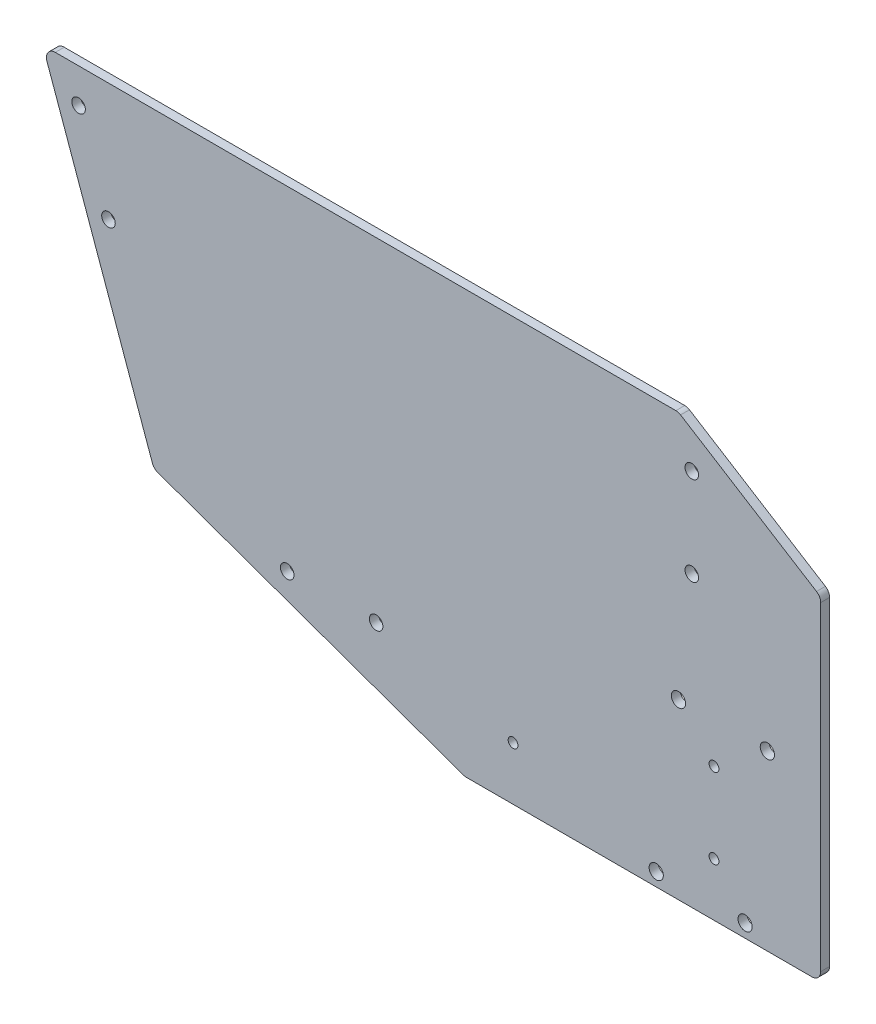
from build123d import *

# Parameters (mm, degrees)
SKETCH_1_R          = 1.6
SKETCH_1_R_2        = 1.525
EXTRUDE_1_DEPTH     = 2
SKETCH_4_R          = 1.1
CUT_EXTRUDE_2_DEPTH = 10
SKETCH_5_OUTSIDE_W  = 216.826
SKETCH_5_OUTSIDE_H  = 136.826
CUT_EXTRUDE_3_DEPTH = 10


with BuildPart() as part:
    # 草图1 → 凸台-拉伸1 (new body)
    with BuildSketch(Plane.XY):
        Polygon((0, 0), (0, 75), (-32, 95), (-175, 95), (-150, 25), (-80, 0), align=None)
        with Locations((-17, 3)):
            Circle(SKETCH_1_R, mode=Mode.SUBTRACT)
        with Locations((-37, 3)):
            Circle(SKETCH_1_R, mode=Mode.SUBTRACT)
        with Locations((-166.927926472, 87.264262869)):
            Circle(SKETCH_1_R_2, mode=Mode.SUBTRACT)
        with Locations((-160.201198532, 68.429424637)):
            Circle(SKETCH_1_R_2, mode=Mode.SUBTRACT)
        with Locations((-29, 85)):
            Circle(SKETCH_1_R_2, mode=Mode.SUBTRACT)
        with Locations((-29, 65)):
            Circle(SKETCH_1_R_2, mode=Mode.SUBTRACT)
        with Locations((-12, 39)):
            Circle(SKETCH_1_R, mode=Mode.SUBTRACT)
        with Locations((-32, 39)):
            Circle(SKETCH_1_R, mode=Mode.SUBTRACT)
        with Locations((-120, 20)):
            Circle(SKETCH_1_R_2, mode=Mode.SUBTRACT)
        with Locations((-100, 20)):
            Circle(SKETCH_1_R_2, mode=Mode.SUBTRACT)
    extrude(amount=EXTRUDE_1_DEPTH)

    # 草图4 → 切除-拉伸2 (cut)
    with BuildSketch(Plane(origin=(0, 0, 0), x_dir=(-1, 0, 0), z_dir=(0, 0, -1))):
        with Locations((24, 30)):
            Circle(SKETCH_4_R)
        with Locations((24, 12)):
            Circle(SKETCH_4_R)
        with Locations((69.2, 12)):
            Circle(SKETCH_4_R)
    extrude(amount=-CUT_EXTRUDE_2_DEPTH, mode=Mode.SUBTRACT)

    # 草图5 outside → 切除-拉伸3 (cut)
    with BuildSketch(Plane(origin=(0, 0, 0), x_dir=(-1, 0, 0), z_dir=(0, 0, -1))):
        with Locations((87.5, 47.5)):
            Rectangle(SKETCH_5_OUTSIDE_W, SKETCH_5_OUTSIDE_H)
        with BuildLine():
            Line((2, 0), (79.653572501, 0))
            ThreePointArc((79.653572501, 0), (79.994917161, 0.029344316), (80.326245295, 0.116516177))
            Line((80.326245295, 0.116516177), (149.107823452, 24.681365519))
            ThreePointArc((149.107823452, 24.681365519), (149.849364221, 25.150635779), (150.318634481, 25.892176548))
            Line((150.318634481, 25.892176548), (174.045474002, 92.327327206))
            ThreePointArc((174.045474002, 92.327327206), (173.7968213, 94.152096874), (172.161990179, 95))
            Line((172.161990179, 95), (32.573592453, 95))
            ThreePointArc((32.573592453, 95), (32.022227427, 94.922497492), (31.513594573, 94.695996608))
            Line((31.513594573, 94.695996608), (0.94000212, 75.587501325))
            ThreePointArc((0.94000212, 75.587501325), (0.250715038, 74.861041782), (0, 73.891504717))
            Line((0, 73.891504717), (0, 2))
            ThreePointArc((0, 2), (0.585786438, 0.585786438), (2, 0))
        make_face(mode=Mode.SUBTRACT)
    extrude(amount=-CUT_EXTRUDE_3_DEPTH, mode=Mode.SUBTRACT)


solid = part.part
